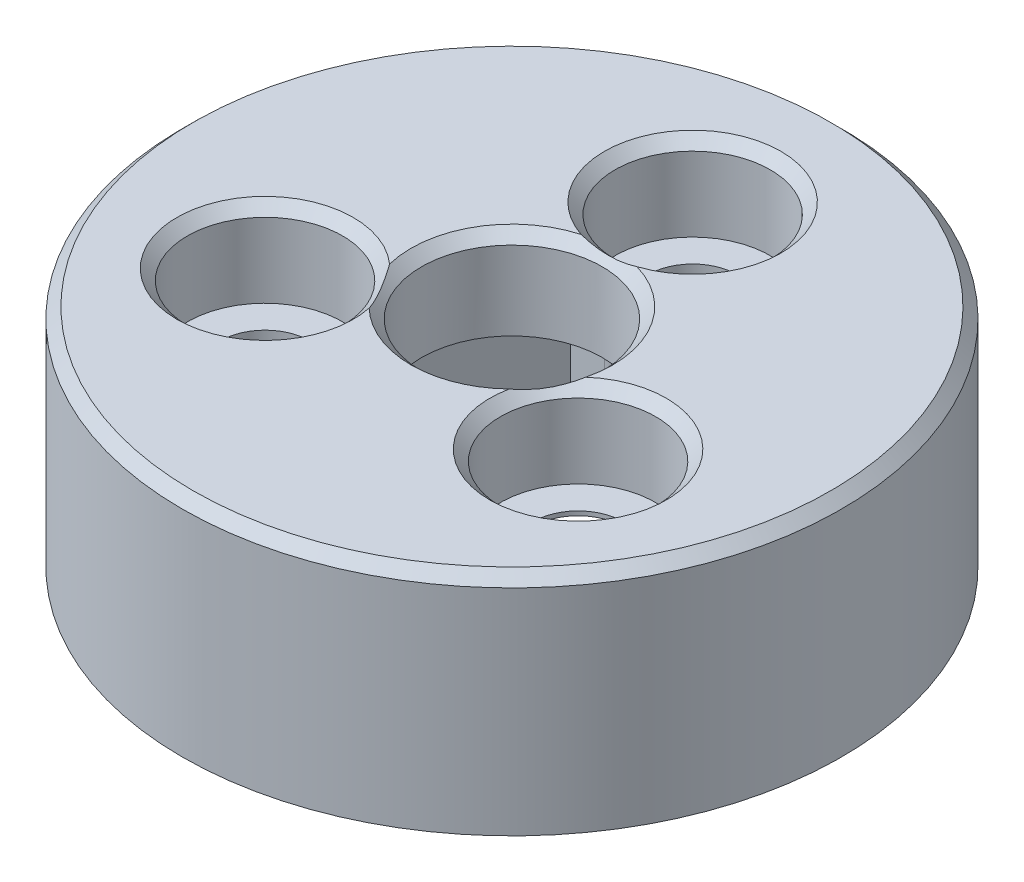
from build123d import *

# Parameters (mm, degrees)
SKETCH1_R           = 15.5
BOSS_EXTRUDE1_DEPTH = 10.6
SKETCH2_R           = 2.1
CUT_EXTRUDE1_DEPTH  = 25.348716599
SKETCH3_R           = 4.25
CUT_EXTRUDE2_DEPTH  = 25.348716599
CUT_EXTRUDE3_DEPTH  = 6.4
SKETCH5_R           = 3.65
CUT_EXTRUDE4_DEPTH  = 4
CHAMFER1_SIZE       = 0.5
FILLET_1_R          = 0.5


with BuildPart() as part:
    # Sketch1 → Boss-Extrude1 (new body)
    with BuildSketch(Plane(origin=(0, 0, 0), x_dir=(1, 0, 0), z_dir=(0, 1, 0))):
        with Locations(Location((0, 0, 0), (0, 0, 270))):
            Circle(SKETCH1_R)
    extrude(amount=BOSS_EXTRUDE1_DEPTH)

    # Sketch2 → Cut-Extrude1 (cut, through all)
    with BuildSketch(Plane(origin=(0, 10.6, 0), x_dir=(1, 0, 0), z_dir=(0, 1, 0))):
        with Locations(Location((0, 8.5, 0), (0, 0, 270))):
            Circle(SKETCH2_R)
        with Locations(Location((7.361215932, -4.25, 0), (0, 0, 270))):
            Circle(SKETCH2_R)
        with Locations(Location((-7.361215932, -4.25, 0), (0, 0, 270))):
            Circle(SKETCH2_R)
    extrude(amount=-CUT_EXTRUDE1_DEPTH, mode=Mode.SUBTRACT)

    # Sketch3 → Cut-Extrude2 (cut, through all)
    with BuildSketch(Plane(origin=(0, 10.6, 0), x_dir=(1, 0, 0), z_dir=(0, 1, 0))):
        with Locations(Location((0, 0, 0), (0, 0, 270))):
            Circle(SKETCH3_R)
    extrude(amount=-CUT_EXTRUDE2_DEPTH, mode=Mode.SUBTRACT)

    # Sketch4 → Cut-Extrude3 (cut)
    with BuildSketch(Plane.XZ):
        Polygon((3.740942098, -6.44013604), (7.447792464, 0.019682871), (3.706850366, 6.459818911), (-3.740942098, 6.44013604), (-7.447792464, -0.019682871), (-3.706850366, -6.459818911), align=None)
    extrude(amount=-CUT_EXTRUDE3_DEPTH, mode=Mode.SUBTRACT)

    # Sketch5 → Cut-Extrude4 (cut)
    with BuildSketch(Plane(origin=(0, 10.6, 0), x_dir=(1, 0, 0), z_dir=(0, 1, 0))):
        with Locations(Location((0, 8.5, 0), (0, 0, 270))):
            Circle(SKETCH5_R)
        with Locations(Location((7.361215932, -4.25, 0), (0, 0, 270))):
            Circle(SKETCH5_R)
        with Locations(Location((-7.361215932, -4.25, 0), (0, 0, 270))):
            Circle(SKETCH5_R)
    extrude(amount=-CUT_EXTRUDE4_DEPTH, mode=Mode.SUBTRACT)

    # Chamfer1
    # the kernel refuses this chamfer: 0.5 mm, written as the material it takes off along each edge
    with BuildSketch(Plane(origin=(0, 10.6, 0), x_dir=(0, 0, 1), z_dir=(-1, 0, 0))) as chamfer1_piece_1:
        Polygon((4.25 + CHAMFER1_SIZE, 0), (4.25, -CHAMFER1_SIZE), (4.25, 0), align=None)
    revolve(axis=Axis((0, 10.6, 0), (0, 1, 0)), mode=Mode.SUBTRACT)
    with BuildSketch(Plane(origin=(0, 10.6, 0), x_dir=(0, 0, 1), z_dir=(-1, 0, 0))) as chamfer1_piece_2:
        Polygon((15.5, -CHAMFER1_SIZE), (15.5 - CHAMFER1_SIZE, 0), (15.5, 0), align=None)
    revolve(axis=Axis((0, 10.6, 0), (0, 1, 0)), mode=Mode.SUBTRACT)
    with BuildSketch(Plane(origin=(0, 10.6, -8.5), x_dir=(0, 0, 1), z_dir=(-1, 0, 0))) as chamfer1_piece_3:
        Polygon((3.65 + CHAMFER1_SIZE, 0), (3.65, -CHAMFER1_SIZE), (3.65, 0), align=None)
    revolve(axis=Axis((0, 10.6, -8.5), (0, 1, 0)), mode=Mode.SUBTRACT)
    with BuildSketch(Plane(origin=(7.361215932, 10.6, 4.25), x_dir=(0, 0, 1), z_dir=(-1, 0, 0))) as chamfer1_piece_4:
        Polygon((3.65 + CHAMFER1_SIZE, 0), (3.65, -CHAMFER1_SIZE), (3.65, 0), align=None)
    revolve(axis=Axis((7.361215932, 10.6, 4.25), (0, 1, 0)), mode=Mode.SUBTRACT)
    with BuildSketch(Plane(origin=(-7.361215932, 10.6, 4.25), x_dir=(0, 0, 1), z_dir=(-1, 0, 0))) as chamfer1_piece_5:
        Polygon((3.65 + CHAMFER1_SIZE, 0), (3.65, -CHAMFER1_SIZE), (3.65, 0), align=None)
    revolve(axis=Axis((-7.361215932, 10.6, 4.25), (0, 1, 0)), mode=Mode.SUBTRACT)

    # Скругление1
    fillet_1_edges = [part.edges().sort_by_distance(p)[0] for p in [
        (5.359734874, 3.2, 3.614332183),
        (5.817474247, 3.2, 2.826321101),
        (-5.809970925, 3.2, 2.834500467),
        (-5.356402996, 3.2, 3.624919933),
        (0.450236051, 3.2, -6.44883265),
        (-0.461071251, 3.2, -6.451241034),
    ]]
    fillet(fillet_1_edges, radius=FILLET_1_R)


solid = part.part
